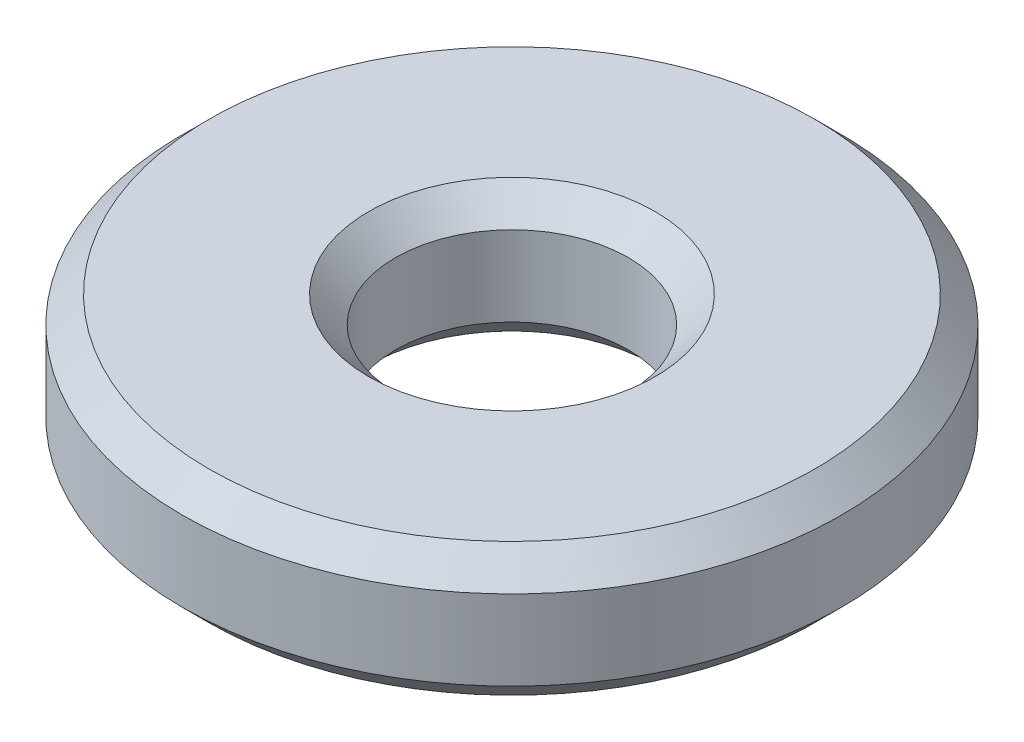
from build123d import *

# Parameters (mm, degrees)
SKETCH2_R           = 4.95
SKETCH2_R_2         = 1.75
BOSS_EXTRUDE1_DEPTH = 2
CHAMFER1_SIZE       = 0.4


with BuildPart() as part:
    # Sketch2 → Boss-Extrude1 (new body)
    with BuildSketch(Plane(origin=(0, 0, 0), x_dir=(1, 0, 0), z_dir=(0, 1, 0))):
        Circle(SKETCH2_R)
        Circle(SKETCH2_R_2, mode=Mode.SUBTRACT)
    extrude(amount=BOSS_EXTRUDE1_DEPTH)

    # Chamfer1
    chamfer1_edges = [part.edges().sort_by_distance(p)[0] for p in [
        (-4.95, 0, 0),
        (-1.75, 0, 0),
        (-4.95, 2, 0),
        (-1.75, 2, 0),
    ]]
    chamfer(chamfer1_edges, length=CHAMFER1_SIZE)


solid = part.part
